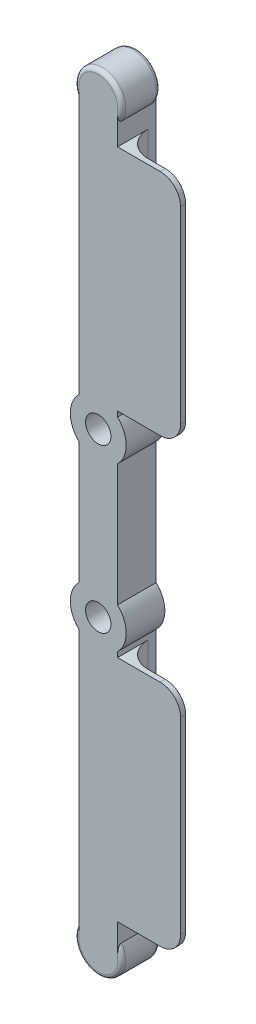
from build123d import *

# Parameters (mm, degrees)
SKETCH1_R            = 2.5
BOSS_EXTRUDE1_DEPTH  = 7.6
SKETCH4_W            = 20
SKETCH4_H            = 45
BOSS_EXTRUDE2_DEPTH  = 1
FILLET3_R            = 0.8
FILLET2_R            = 4
FILLET1_R            = 5
FILLET3_OF_MIRROR1_R = 0.8
FILLET2_OF_MIRROR1_R = 4
FILLET1_OF_MIRROR1_R = 5


with BuildPart() as part:
    # Sketch1 → Boss-Extrude1 (new body)
    with BuildSketch(Plane.XY):
        with BuildLine():
            Line((3.8, -44.02382093), (3.8, 6))
            ThreePointArc((3.8, 6), (0, 13.252645761), (-3.8, 6))
            Line((-3.8, 6), (-3.8, -44.02382093))
            ThreePointArc((-3.8, -44.02382093), (-5.5, -48), (-3.8, -51.97617907))
            Line((-3.8, -51.97617907), (-3.8, -64))
            Line((-3.8, -64), (3.8, -64))
            Line((3.8, -64), (3.8, -51.97617907))
            ThreePointArc((3.8, -51.97617907), (5.5, -48), (3.8, -44.02382093))
        make_face()
        with Locations((0, -48)):
            Circle(SKETCH1_R, mode=Mode.SUBTRACT)
    boss_extrude1 = extrude(amount=BOSS_EXTRUDE1_DEPTH)

    # Sketch4 → Boss-Extrude2 (add)
    with BuildSketch(Plane.XY.offset(7.6)):
        with Locations((6.2, -20.5)):
            Rectangle(SKETCH4_W, SKETCH4_H)
    boss_extrude2 = extrude(amount=-BOSS_EXTRUDE2_DEPTH)

    # Fillet3
    fillet3_edges = [part.edges().sort_by_distance(p)[0] for p in [
        (0, 13.252645761, 0),
        (0, 13.252645761, 7.6),
    ]]
    fillet(fillet3_edges, radius=FILLET3_R)

    # Fillet2
    fillet2_edges = [part.edges().sort_by_distance(p)[0] for p in [
        (16.2, 2, 7.1),
        (16.2, -43, 7.1),
    ]]
    fillet(fillet2_edges, radius=FILLET2_R)

    # Fillet1
    fillet1_edges = [part.edges().sort_by_distance(p)[0] for p in [
        (3.8, -20.5, 6.6),
    ]]
    fillet(fillet1_edges, radius=FILLET1_R)

    # Mirror1: Boss-Extrude1, Boss-Extrude2 across plane
    add(boss_extrude1.mirror(Plane(origin=(0, -64, 0), x_dir=(0, 0, 1), z_dir=(0, -1, 0))))
    add(boss_extrude2.mirror(Plane(origin=(0, -64, 0), x_dir=(0, 0, 1), z_dir=(0, -1, 0))))

    # Fillet3 of Mirror1
    fillet3_of_mirror1_edges = [part.edges().sort_by_distance(p)[0] for p in [
        (0, -141.252645761, 0),
        (0, -141.252645761, 7.6),
    ]]
    fillet(fillet3_of_mirror1_edges, radius=FILLET3_OF_MIRROR1_R)

    # Fillet2 of Mirror1
    fillet2_of_mirror1_edges = [part.edges().sort_by_distance(p)[0] for p in [
        (16.2, -130, 7.1),
        (16.2, -85, 7.1),
    ]]
    fillet(fillet2_of_mirror1_edges, radius=FILLET2_OF_MIRROR1_R)

    # Fillet1 of Mirror1
    fillet1_of_mirror1_edges = [part.edges().sort_by_distance(p)[0] for p in [
        (3.8, -107.5, 6.6),
    ]]
    fillet(fillet1_of_mirror1_edges, radius=FILLET1_OF_MIRROR1_R)


solid = part.part
